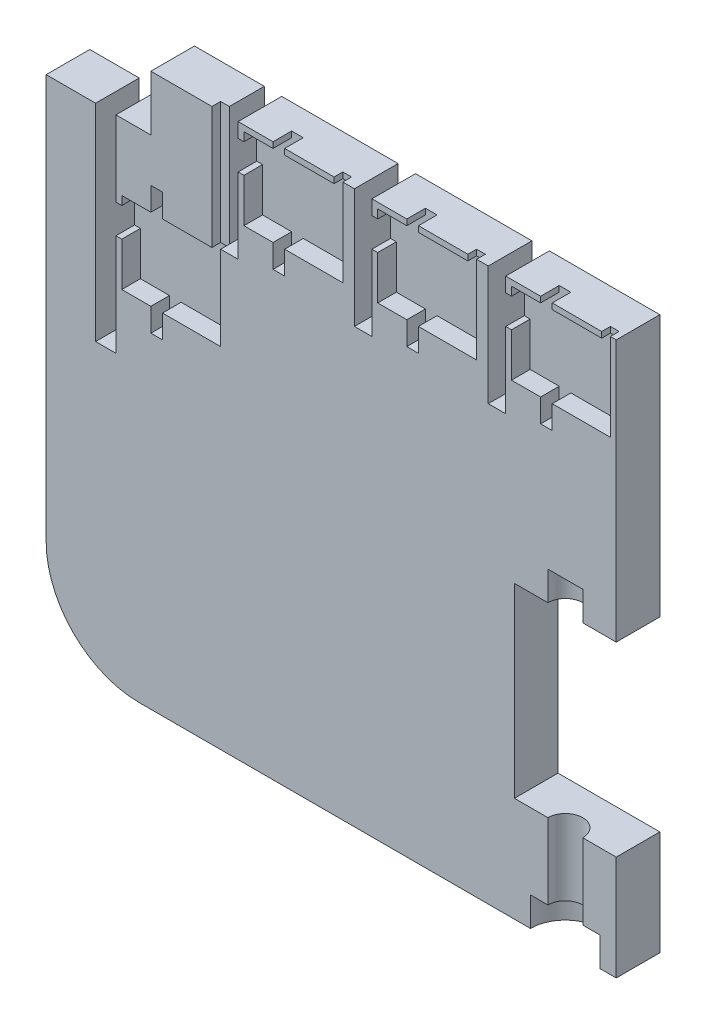
from build123d import *
from OCP.BRepAlgoAPI import BRepAlgoAPI_Cut
from OCP.TopTools import TopTools_ListOfShape

# Parameters (mm, degrees)
BOSS_EXTRUDE1_DEPTH = 7.5
CUT_EXTRUDE1_DEPTH  = 3.2
CUT_EXTRUDE2_DEPTH  = 5
CUT_EXTRUDE3_DEPTH  = 50
CUT_EXTRUDE4_REACH  = 70.655
SKETCH5_W           = 3
SKETCH5_H           = 17
CUT_EXTRUDE5_REACH  = 70.655
SKETCH8_W           = 12
SKETCH8_H           = 37
CUT_EXTRUDE6_DEPTH  = 3.2
SKETCH10_W          = 10
SKETCH10_H          = 7.5
BOSS_EXTRUDE2_DEPTH = 27.486353186
SKETCH11_W          = 3
SKETCH11_H          = 7.5
CUT_EXTRUDE7_DEPTH  = 3.5
SKETCH12_W          = 2
SKETCH12_H          = 7.5
CUT_EXTRUDE8_DEPTH  = 4
SKETCH13_W          = 2
SKETCH13_H          = 7.5
CUT_EXTRUDE9_DEPTH  = 4
SKETCH14_W          = 7.5
SKETCH14_H          = 9.5
CUT_EXTRUDE10_DEPTH = 6
SKETCH15_W          = 1.5
SKETCH15_H          = 21
SKETCH15_H_2        = 1
CUT_EXTRUDE11_DEPTH = 1.5
SKETCH16_W          = 1.5
SKETCH16_H          = 7.5
CUT_EXTRUDE12_DEPTH = 35.486360958


with BuildPart() as part:
    # Sketch1 → Boss-Extrude1 (new body)
    with BuildSketch(Plane.XY):
        with BuildLine():
            Line((-33, -47.5), (49, -47.5))
            Line((49, -47.5), (49, -29.5))
            Line((49, -29.5), (31.5, -29.5))
            Line((31.5, -29.5), (31.5, 2.5))
            Line((31.5, 2.5), (49, 2.5))
            Line((49, 2.5), (49, 47.5))
            Line((49, 47.5), (30, 47.5))
            Line((30, 47.5), (30, 30.5))
            Line((30, 30.5), (27, 30.5))
            Line((27, 30.5), (27, 47.5))
            Line((27, 47.5), (-49, 47.5))
            Line((-49, 47.5), (-49, -31.5))
            ThreePointArc((-49, -31.5), (-44.313708499, -42.813708499), (-33, -47.5))
        make_face()
    extrude(amount=BOSS_EXTRUDE1_DEPTH)

    # Sketch2 → Cut-Extrude1 (cut)
    with BuildSketch(Plane.XY.offset(7.5)):
        Polygon((30, 40), (31, 40), (31, 32.5), (36, 32.5), (36, 28.5), (38, 28.5), (38, 32.5), (48, 32.5), (48, 46.5), (38, 46.5), (38, 47.5), (36, 47.5), (36, 46.5), (31, 46.5), (31, 45), (30, 45), align=None)
        Polygon((-16, 40), (-15, 40), (-15, 32.5), (-10, 32.5), (-10, 28.5), (-8, 28.5), (-8, 32.5), (2, 32.5), (2, 46.5), (-8, 46.5), (-8, 47.5), (-10, 47.5), (-10, 46.5), (-15, 46.5), (-15, 45), (-16, 45), align=None)
        Polygon((7, 40), (8, 40), (8, 32.5), (13, 32.5), (13, 28.5), (15, 28.5), (15, 32.5), (25, 32.5), (25, 46.5), (15, 46.5), (15, 47.5), (13, 47.5), (13, 46.5), (8, 46.5), (8, 45), (7, 45), align=None)
    extrude(amount=-CUT_EXTRUDE1_DEPTH, mode=Mode.SUBTRACT)

    # Sketch3 → Cut-Extrude2 (cut)
    with BuildSketch(Plane.XZ.offset(47.5)):
        with BuildLine():
            Line((34.25, 7.5), (46.25, 7.5))
            ThreePointArc((46.25, 7.5), (40.25, 1.5), (34.25, 7.5))
        make_face()
    extrude(amount=-CUT_EXTRUDE2_DEPTH, mode=Mode.SUBTRACT)

    # Sketch4 → Cut-Extrude3 (cut)
    with BuildSketch(Plane.XZ.offset(42.5)):
        with BuildLine():
            Line((37.25, 7.5), (43.25, 7.5))
            ThreePointArc((43.25, 7.5), (40.25, 4.5), (37.25, 7.5))
        make_face()
    extrude(amount=-CUT_EXTRUDE3_DEPTH, mode=Mode.SUBTRACT)

    # Sketch5 → Cut-Extrude4 (cut, up to next)
    with BuildSketch(Plane.XY.offset(7.5), mode=Mode.PRIVATE) as cut_extrude4_sk1:
        with Locations((5.5, 39)):
            Rectangle(SKETCH5_W, SKETCH5_H)
    cut_extrude4_tool1 = extrude(cut_extrude4_sk1.sketch, amount=-CUT_EXTRUDE4_REACH, mode=Mode.PRIVATE) & part.part
    # Sketch5 → Cut-Extrude4 (cut, up to next)
    with BuildSketch(Plane.XY.offset(7.5), mode=Mode.PRIVATE) as cut_extrude4_sk2:
        with Locations((-17.5, 39)):
            Rectangle(SKETCH5_W, SKETCH5_H)
    cut_extrude4_tool2 = extrude(cut_extrude4_sk2.sketch, amount=-CUT_EXTRUDE4_REACH, mode=Mode.PRIVATE) & part.part
    add(cut_extrude4_tool1.solids().sort_by_distance((5.5, 39, 7.5))[0], mode=Mode.SUBTRACT)
    add(cut_extrude4_tool2.solids().sort_by_distance((-17.5, 39, 7.5))[0], mode=Mode.SUBTRACT)

    # Sketch8 → Cut-Extrude5 (cut, up to next)
    with BuildSketch(Plane.XY.offset(7.5), mode=Mode.PRIVATE) as cut_extrude5_sk1:
        with Locations((-43, 29)):
            Rectangle(SKETCH8_W, SKETCH8_H)
    cut_extrude5_tool1 = extrude(cut_extrude5_sk1.sketch, amount=-CUT_EXTRUDE5_REACH, mode=Mode.PRIVATE) & part.part
    add(cut_extrude5_tool1.solids().sort_by_distance((-43, 29, 7.5))[0], mode=Mode.SUBTRACT)

    # Sketch9 → Cut-Extrude6 (cut)
    with BuildSketch(Plane.XY.offset(7.5)):
        Polygon((-37, 20), (-36, 20), (-36, 12.5), (-31, 12.5), (-31, 8.5), (-29, 8.5), (-29, 12.5), (-19, 12.5), (-19, 26.5), (-29, 26.5), (-29, 30.5), (-31, 30.5), (-31, 26.5), (-36, 26.5), (-36, 25), (-37, 25), align=None)
    extrude(amount=-CUT_EXTRUDE6_DEPTH, mode=Mode.SUBTRACT)

    # Sketch10 → Boss-Extrude2 (add)
    with BuildSketch(Plane(origin=(0, 10.5, 0), x_dir=(1, 0, 0), z_dir=(0, 1, 0))):
        with Locations((-44, -3.75)):
            Rectangle(SKETCH10_W, SKETCH10_H)
    extrude(amount=BOSS_EXTRUDE2_DEPTH)

    # Sketch11 → Cut-Extrude7 (cut)
    with BuildSketch(Plane(origin=(0, 30.5, 0), x_dir=(1, 0, 0), z_dir=(0, 1, 0))):
        with Locations((-17.5, -3.75)):
            Rectangle(SKETCH11_W, SKETCH11_H)
        with Locations((5.5, -3.75)):
            Rectangle(SKETCH11_W, SKETCH11_H)
        with Locations((28.5, -3.75)):
            Rectangle(SKETCH11_W, SKETCH11_H)
    extrude(amount=-CUT_EXTRUDE7_DEPTH, mode=Mode.SUBTRACT)

    # Sketch12 → Cut-Extrude8 (cut)
    with BuildSketch(Plane(origin=(0, 10.5, 0), x_dir=(1, 0, 0), z_dir=(0, 1, 0))):
        with Locations((-38, -3.75)):
            Rectangle(SKETCH12_W, SKETCH12_H)
    extrude(amount=-CUT_EXTRUDE8_DEPTH, mode=Mode.SUBTRACT)

    # Sketch13 → Cut-Extrude9 (cut)
    with BuildSketch(Plane(origin=(0, 6.5, 0), x_dir=(1, 0, 0), z_dir=(0, 1, 0))):
        with Locations((-38, -3.75)):
            Rectangle(SKETCH13_W, SKETCH13_H)
    extrude(amount=-CUT_EXTRUDE9_DEPTH, mode=Mode.SUBTRACT)

    # Sketch14 → Cut-Extrude10 (cut)
    with BuildSketch(Plane.ZY.offset(37)):
        with Locations((3.75, 42.75)):
            Rectangle(SKETCH14_W, SKETCH14_H)
    extrude(amount=-CUT_EXTRUDE10_DEPTH, mode=Mode.SUBTRACT)

    # Sketch15 → Cut-Extrude11 (cut)
    with BuildSketch(Plane.XY.offset(7.5)):
        with Locations((-19.75, 37)):
            Rectangle(SKETCH15_W, SKETCH15_H)
        with Locations((1.25, 47)):
            Rectangle(SKETCH15_W, SKETCH15_H_2)
        with Locations((24.25, 47)):
            Rectangle(SKETCH15_W, SKETCH15_H_2)
        with Locations((47.25, 47)):
            Rectangle(SKETCH15_W, SKETCH15_H_2)
    extrude(amount=-CUT_EXTRUDE11_DEPTH, mode=Mode.SUBTRACT)


with BuildPart() as cut_extrude12_tool:
    # Sketch16 → Cut-Extrude12 (new body)
    with BuildSketch(Plane(origin=(0, 37.986353186, 0), x_dir=(1, 0, 0), z_dir=(0, 1, 0))):
        with Locations((-39.75, -3.75)):
            Rectangle(SKETCH16_W, SKETCH16_H)
    extrude(amount=-CUT_EXTRUDE12_DEPTH)


with BuildPart() as part_1:
    add(part.part)

    # Cut-Extrude12: cut by cut_extrude12_tool, with a tolerance
    cut_extrude12_stock = TopTools_ListOfShape()
    cut_extrude12_stock.Append(part_1.part.wrapped)
    cut_extrude12_tools = TopTools_ListOfShape()
    cut_extrude12_tools.Append(cut_extrude12_tool.part.wrapped)
    cut_extrude12_cut = BRepAlgoAPI_Cut()
    cut_extrude12_cut.SetArguments(cut_extrude12_stock)
    cut_extrude12_cut.SetTools(cut_extrude12_tools)
    cut_extrude12_cut.SetFuzzyValue(0.00001)
    cut_extrude12_cut.Build()
    add(Compound.cast(cut_extrude12_cut.Shape()).solids(), mode=Mode.REPLACE)


solid = part_1.part
